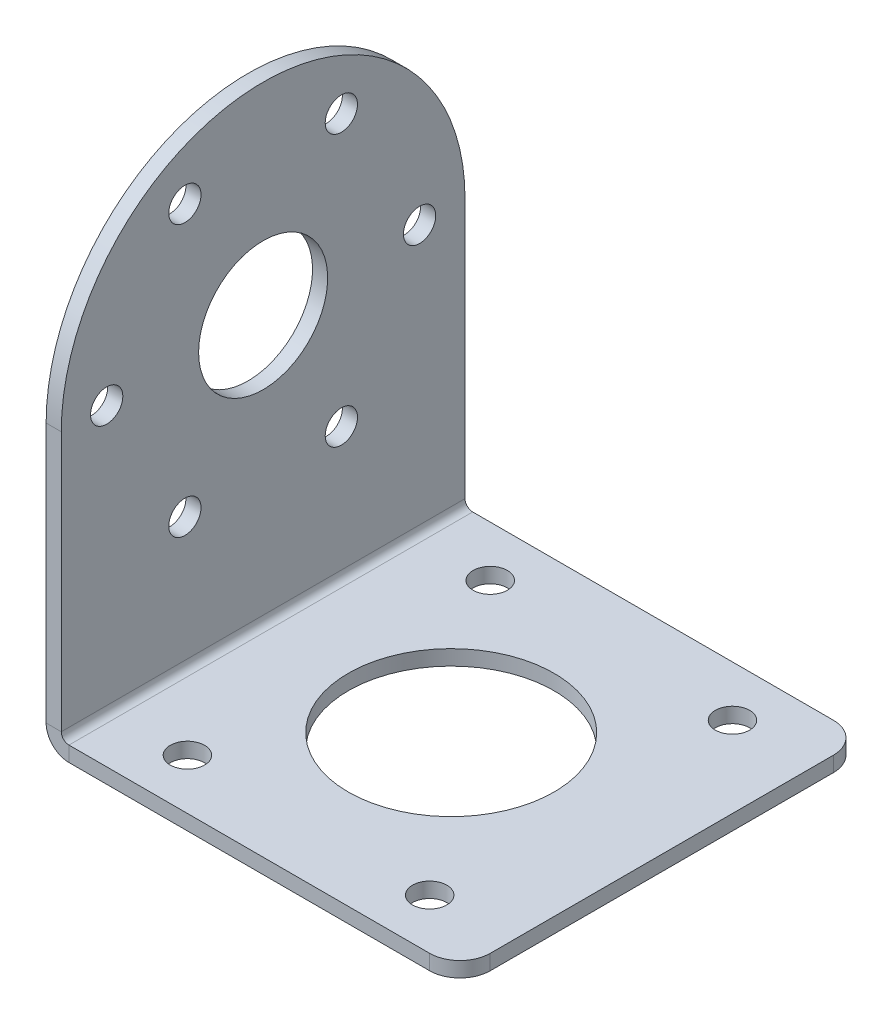
from build123d import *

# Parameters (mm, degrees)
BOSS_EXTRUDE1_DEPTH    = 1.5
SKETCH2_W              = 41
SKETCH2_H              = 40
BOSS_EXTRUDE2_DEPTH    = 1.5
CONVERT_SOLID1_START   = -20
CONVERT_SOLID1_DEPTH   = 40
CONVERT_SOLID1_2_DEPTH = 40
M3_CLEARANCE_HOLE1_D   = 3.2
CIRPATTERN1_COUNT      = 6
SKETCH9_R              = 6.393167934
CUT_EXTRUDE1_DEPTH     = 54.525694764
M3_CLEARANCE_HOLE2_D   = 3.4
LPATTERN1_COUNT        = 2
LPATTERN1_PITCH        = 24
LPATTERN1_COPY_1_D     = 3.4
FILLET1_R              = 3
SKETCH12_R             = 10.195045523
CUT_EXTRUDE2_DEPTH     = 10


# Read off the part's stored shape, not the designer's step: Convert-Solid1
with BuildPart() as part:
    # Sketch1 → Boss-Extrude1 (new body)
    with BuildSketch(Plane(origin=(0, 0, 0), x_dir=(0, 0, -1), z_dir=(1, 0, 0))):
        with BuildLine():
            Line((-20, 0), (-20, -28))
            Line((-20, -28), (20, -28))
            Line((20, -28), (20, 0))
            ThreePointArc((20, 0), (0, 20), (-20, 0))
        make_face()
    extrude(amount=BOSS_EXTRUDE1_DEPTH)

    # Sketch2 → Boss-Extrude2 (add)
    with BuildSketch(Plane.XZ.offset(28)):
        with Locations((20.5, 0)):
            Rectangle(SKETCH2_W, SKETCH2_H)
    extrude(amount=-BOSS_EXTRUDE2_DEPTH)

    # Convert-Solid1 outline → Convert-Solid1 (cut)
    with BuildSketch(Plane.XY.offset(CONVERT_SOLID1_START)):
        with BuildLine():
            Line((0, -28), (2.262, -28))
            ThreePointArc((2.262, -28), (0.662524461, -27.337475539), (0, -25.738))
            Line((0, -25.738), (0, -28))
        make_face()
    extrude(amount=CONVERT_SOLID1_DEPTH, mode=Mode.SUBTRACT)

    # Convert-Solid1 2 outline → Convert-Solid1 2 (add)
    with BuildSketch(Plane.XY.offset(CONVERT_SOLID1_START)):
        with BuildLine():
            Line((1.5, -26.5), (2.262, -26.5))
            ThreePointArc((2.262, -26.5), (1.723184633, -26.276815367), (1.5, -25.738))
            Line((1.5, -25.738), (1.5, -26.5))
        make_face()
    extrude(amount=CONVERT_SOLID1_2_DEPTH)

    # M3 Clearance Hole1 (through all)
    with Locations(Plane.ZY):
        with Locations((-15.5, 0)):
            m3_clearance_hole1 = Hole(M3_CLEARANCE_HOLE1_D / 2)

    # CirPattern1: M3 Clearance Hole1 ×6 about axis
    cirpattern1_axis = Axis((0, 0, 0), (1, 0, 0))
    for i in range(1, CIRPATTERN1_COUNT):
        add(m3_clearance_hole1.rotate(cirpattern1_axis, i * 360 / CIRPATTERN1_COUNT), mode=Mode.SUBTRACT)

    # Sketch9 → Cut-Extrude1 (cut, through all)
    with BuildSketch(Plane.ZY):
        Circle(SKETCH9_R)
    extrude(amount=-CUT_EXTRUDE1_DEPTH, mode=Mode.SUBTRACT)

    # M3 Clearance Hole2 (through all)
    with Locations(Plane(origin=(0, -26.5, 0), x_dir=(1, 0, 0), z_dir=(0, 1, 0))):
        with Locations((33, 15)):
            m3_clearance_hole2 = Hole(M3_CLEARANCE_HOLE2_D / 2)

    # Mirror1: M3 Clearance Hole2 across plane
    add(m3_clearance_hole2.mirror(Plane.XY), mode=Mode.SUBTRACT)

    # LPattern1: M3 Clearance Hole2 ×2
    with Locations(*[(-i * LPATTERN1_PITCH, 0, 0) for i in range(1, LPATTERN1_COUNT)]):
        add(m3_clearance_hole2, mode=Mode.SUBTRACT)

    # LPattern1 copy 1 (through all)
    with Locations(Plane(origin=(-24, -26.5, 0), x_dir=(1, 0, 0), z_dir=(0, 1, 0))):
        with Locations((33, -15)):
            Hole(LPATTERN1_COPY_1_D / 2)

    # Fillet1
    fillet1_edges = [part.edges().sort_by_distance(p)[0] for p in [
        (41, -27.25, 20),
        (41, -27.25, -20),
    ]]
    fillet(fillet1_edges, radius=FILLET1_R)

    # Sketch12 → Cut-Extrude2 (cut)
    with BuildSketch(Plane(origin=(0, -26.5, 0), x_dir=(1, 0, 0), z_dir=(0, 1, 0))):
        with Locations(Location((20.131, 0, 0), (0, 0, 270))):
            Circle(SKETCH12_R)
    extrude(amount=-CUT_EXTRUDE2_DEPTH, mode=Mode.SUBTRACT)


solid = part.part
